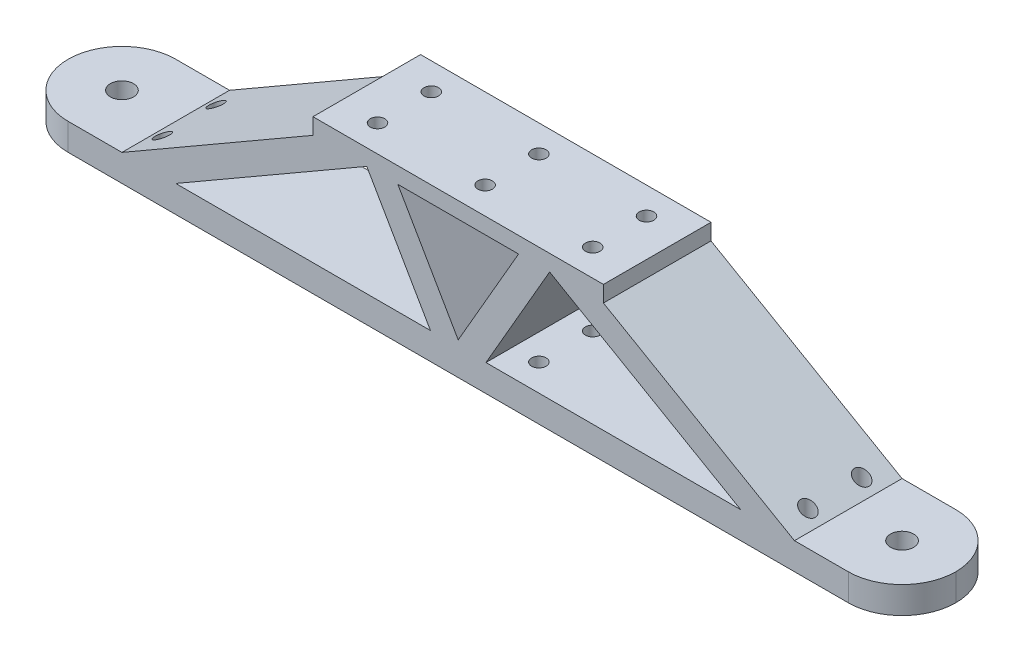
from build123d import *

# Parameters (mm, degrees)
EXTRUDE_1_DEPTH     = 20
SKETCH_2_R          = 2.15
CUT_EXTRUDE_1_DEPTH = 20
SKETCH_3_R          = 1.35
CUT_EXTRUDE_2_DEPTH = 10
FILLET_1_R          = 10
SKETCH_4_R          = 1.35
CUT_EXTRUDE_3_DEPTH = 10


with BuildPart() as part:
    # 스케치1 → 보스-돌출1 (new body)
    with BuildSketch(Plane.XY):
        Polygon((-31.992958445, 23), (-67.5, 2.5), (-87.5, 2.5), (-87.5, -2.5), (77.5, -2.5), (77.5, 2.5), (57.5, 2.5), (21.992958445, 23), (21.992958445, 26), (-31.992958445, 26), align=None)
        Polygon((0.157277926, 2.5), (47.5, 2.5), (11.992958445, 23), align=None, mode=Mode.SUBTRACT)
        Polygon((-16.219455753, 23), (6.219455753, 23), (-5, 3.567332603), align=None, mode=Mode.SUBTRACT)
        Polygon((-21.992958445, 23), (-57.5, 2.5), (-10.157277926, 2.5), align=None, mode=Mode.SUBTRACT)
    extrude(amount=EXTRUDE_1_DEPTH)

    # 스케치2 → 컷-돌출1 (cut)
    with BuildSketch(Plane(origin=(0, 2.5, 0), x_dir=(1, 0, 0), z_dir=(0, 1, 0))):
        with Locations(Location((-77.5, -10, 0), (0, 0, 270))):
            Circle(SKETCH_2_R)
        with Locations(Location((67.5, -10, 0), (0, 0, 270))):
            Circle(SKETCH_2_R)
    extrude(amount=-CUT_EXTRUDE_1_DEPTH, mode=Mode.SUBTRACT)

    # 스케치3 → 컷-돌출2 (cut)
    with BuildSketch(Plane(origin=(0, 26, 0), x_dir=(1, 0, 0), z_dir=(0, 1, 0))):
        with Locations(Location((-25, -5, 0), (0, 0, 270))):
            Circle(SKETCH_3_R)
        with Locations(Location((-25, -15, 0), (0, 0, 270))):
            Circle(SKETCH_3_R)
        with Locations(Location((-5, -5, 0), (0, 0, 270))):
            Circle(SKETCH_3_R)
        with Locations(Location((-5, -15, 0), (0, 0, 270))):
            Circle(SKETCH_3_R)
        with Locations(Location((15, -5, 0), (0, 0, 270))):
            Circle(SKETCH_3_R)
        with Locations(Location((15, -15, 0), (0, 0, 270))):
            Circle(SKETCH_3_R)
    extrude(amount=-CUT_EXTRUDE_2_DEPTH, mode=Mode.SUBTRACT)

    # 필렛1
    fillet_1_edges = [part.edges().sort_by_distance(p)[0] for p in [
        (77.5, 0, 0),
        (77.5, 0, 20),
        (-87.5, 0, 0),
        (-87.5, 0, 20),
    ]]
    fillet(fillet_1_edges, radius=FILLET_1_R - 0.0001)  # a hair under: the kernel refuses the full size

    # 스케치4 → 컷-돌출3 (cut)
    with BuildSketch(Plane.XZ.offset(2.5)):
        with Locations(Location((-65, 15, 0), (0, 0, 270))):
            Circle(SKETCH_4_R)
        with Locations(Location((-65, 5, 0), (0, 0, 270))):
            Circle(SKETCH_4_R)
        with Locations(Location((55, 5, 0), (0, 0, 270))):
            Circle(SKETCH_4_R)
        with Locations(Location((55, 15, 0), (0, 0, 270))):
            Circle(SKETCH_4_R)
        with Locations(Location((-15, 15, 0), (0, 0, 270))):
            Circle(SKETCH_4_R)
        with Locations(Location((5, 15, 0), (0, 0, 270))):
            Circle(SKETCH_4_R)
        with Locations(Location((-15, 5, 0), (0, 0, 270))):
            Circle(SKETCH_4_R)
        with Locations(Location((5, 5, 0), (0, 0, 270))):
            Circle(SKETCH_4_R)
    extrude(amount=-CUT_EXTRUDE_3_DEPTH, mode=Mode.SUBTRACT)


solid = part.part
